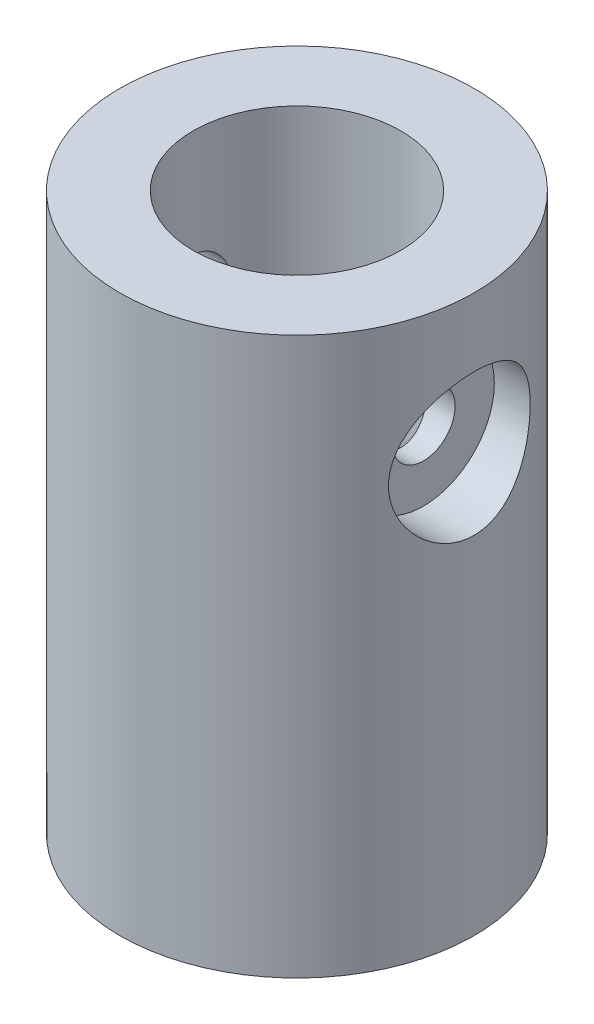
from build123d import *

# Parameters (mm, degrees)
SKETCH1_R                               = 7
BOSS_EXTRUDE1_DEPTH                     = 22
SKETCH2_R                               = 4.1
CUT_EXTRUDE1_DEPTH                      = 14
CUT_EXTRUDE2_DEPTH                      = 8
CBORE_FOR_M5_HEX_HEAD_BOLT1_D           = 2.5
CBORE_FOR_M5_HEX_HEAD_BOLT1_CBORE_D     = 5.6
CBORE_FOR_M5_HEX_HEAD_BOLT1_CBORE_DEPTH = 2


with BuildPart() as part:
    # Sketch1 → Boss-Extrude1 (new body)
    with BuildSketch(Plane(origin=(0, 0, 0), x_dir=(1, 0, 0), z_dir=(0, 1, 0))):
        Circle(SKETCH1_R)
    extrude(amount=BOSS_EXTRUDE1_DEPTH)

    # Sketch2 → Cut-Extrude1 (cut)
    with BuildSketch(Plane(origin=(0, 22, 0), x_dir=(1, 0, 0), z_dir=(0, 1, 0))):
        Circle(SKETCH2_R)
    extrude(amount=-CUT_EXTRUDE1_DEPTH, mode=Mode.SUBTRACT)

    # Sketch3 → Cut-Extrude2 (cut)
    with BuildSketch(Plane.XZ):
        with BuildLine():
            Line((-1.95, 2.00935313), (-1.95, -2.00935313))
            ThreePointArc((-1.95, -2.00935313), (0, -2.8), (1.95, -2.00935313))
            Line((1.95, -2.00935313), (1.95, 2.00935313))
            ThreePointArc((1.95, 2.00935313), (0, 2.8), (-1.95, 2.00935313))
        make_face()
    extrude(amount=-CUT_EXTRUDE2_DEPTH, mode=Mode.SUBTRACT)

    # CBORE for M5 Hex Head Bolt1 (through all)
    with Locations(Plane(origin=(7, 16.5, 0), x_dir=(0, 0, 1), z_dir=(1, 0, 0))):
        with Locations((0, 0)):
            CounterBoreHole(CBORE_FOR_M5_HEX_HEAD_BOLT1_D / 2, CBORE_FOR_M5_HEX_HEAD_BOLT1_CBORE_D / 2, CBORE_FOR_M5_HEX_HEAD_BOLT1_CBORE_DEPTH)


solid = part.part
